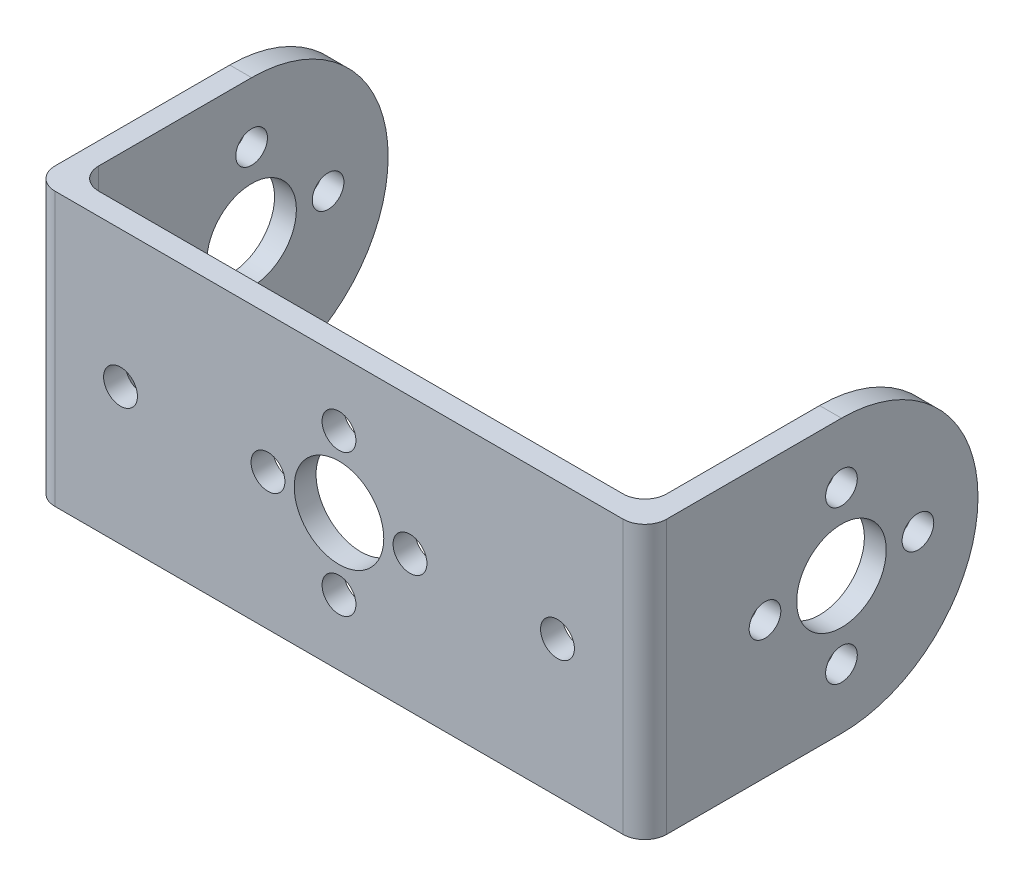
from build123d import *

# Parameters (mm, degrees)
SKETCH_1_W          = 56
SKETCH_1_H          = 25
EXTRUDE_1_DEPTH     = 2
SKETCH_2_R          = 1.45
EXTRUDE_2_DEPTH     = 2
SKETCH_3_R          = 1.55
SKETCH_3_R_2        = 4.1
CUT_EXTRUDE_1_DEPTH = 2
FILLET_1_R          = 2


with BuildPart() as part:
    # 草图1 → 凸台-拉伸1 (new body)
    with BuildSketch(Plane.XY):
        Rectangle(SKETCH_1_W, SKETCH_1_H)
    extrude(amount=EXTRUDE_1_DEPTH)

    # 草图2 → 凸台-拉伸2 (add)
    with BuildSketch(Plane(origin=(28, 0, 0), x_dir=(0, 0, -1), z_dir=(1, 0, 0))):
        with BuildLine():
            Line((16, 12.5), (0, 12.5))
            Line((0, 12.5), (0, -12.5))
            Line((0, -12.5), (16, -12.5))
            ThreePointArc((16, -12.5), (21.8630197, -11.039701083), (26.356157589, -7))
            ThreePointArc((26.356157589, -7), (27.31423641, -5.313949046), (28, -3.5))
            ThreePointArc((28, -3.5), (28.374368671, -1.767766953), (28.5, 0))
            ThreePointArc((28.5, 0), (24.838834765, 8.838834765), (16, 12.5))
        make_face()
        with Locations((9, 0)):
            Circle(SKETCH_2_R, mode=Mode.SUBTRACT)
        with Locations((16, -7)):
            Circle(SKETCH_2_R, mode=Mode.SUBTRACT)
        with BuildLine():
            ThreePointArc((16, 4.1), (18.899137803, 2.899137803), (20.1, 0))
            ThreePointArc((20.1, 0), (13.100862197, -2.899137803), (16, 4.1))
        make_face(mode=Mode.SUBTRACT)
        with BuildLine():
            ThreePointArc((24.45, 0), (23, -1.45), (21.55, 0))
            ThreePointArc((21.55, 0), (23, 1.45), (24.45, 0))
        make_face(mode=Mode.SUBTRACT)
        with BuildLine():
            ThreePointArc((17.45, 7), (17.025304833, 5.974695167), (16, 5.55))
            ThreePointArc((16, 5.55), (14.974695167, 5.974695167), (14.55, 7))
            ThreePointArc((14.55, 7), (14.974695167, 8.025304833), (16, 8.45))
            ThreePointArc((16, 8.45), (17.025304833, 8.025304833), (17.45, 7))
        make_face(mode=Mode.SUBTRACT)
    extrude_2 = extrude(amount=-EXTRUDE_2_DEPTH)

    # 镜向2: 凸台-拉伸2 across plane
    add(extrude_2.mirror(Plane.ZY))

    # 草图3 → 切除-拉伸1 (cut)
    with BuildSketch(Plane.XY.offset(2)):
        with Locations((-20, 0)):
            Circle(SKETCH_3_R)
        with Locations((-6.5, 0)):
            Circle(SKETCH_3_R)
        with Locations((6.5, 0)):
            Circle(SKETCH_3_R)
        with Locations((0, -6.5)):
            Circle(SKETCH_3_R)
        Circle(SKETCH_3_R_2)
        with Locations((0, 6.5)):
            Circle(SKETCH_3_R)
        with Locations((20, 0)):
            Circle(SKETCH_3_R)
    extrude(amount=-CUT_EXTRUDE_1_DEPTH, mode=Mode.SUBTRACT)

    # 圆角1
    fillet_1_edges = [part.edges().sort_by_distance(p)[0] for p in [
        (26, 0, 0),
        (-26, 0, 0),
        (-28, 0, 2),
        (28, 0, 2),
    ]]
    fillet(fillet_1_edges, radius=FILLET_1_R)


solid = part.part
